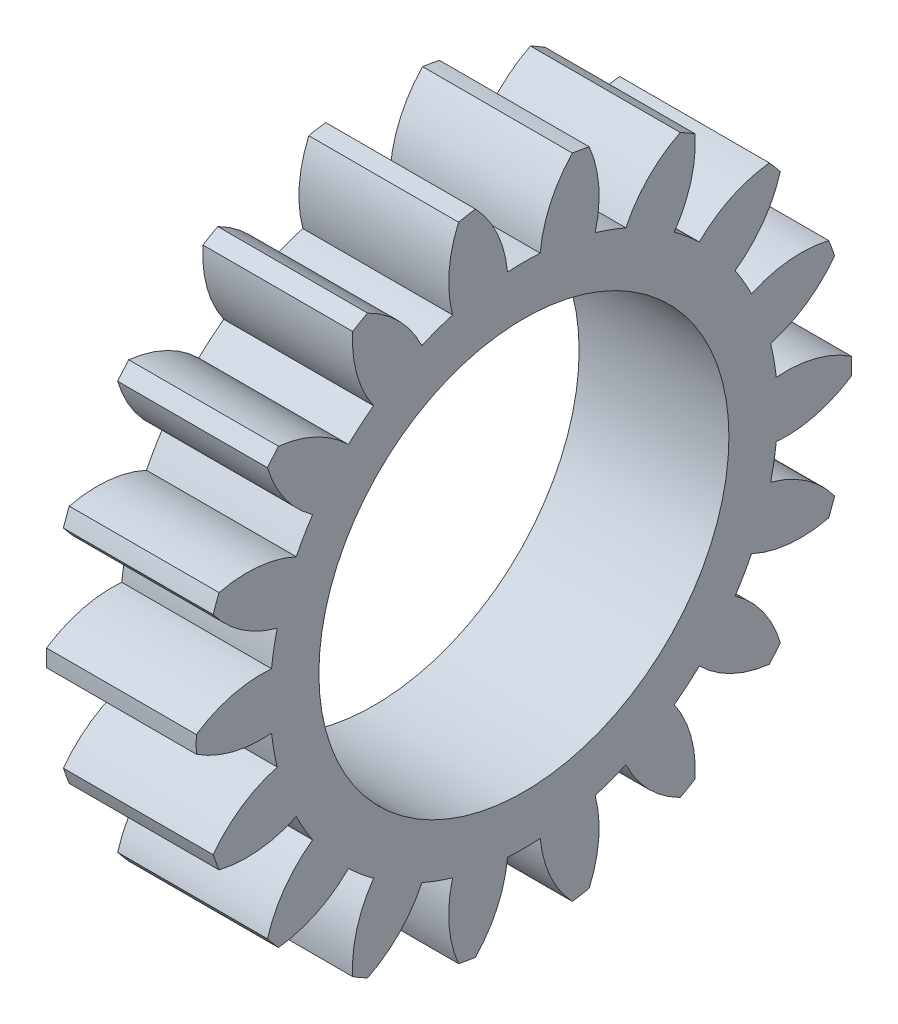
from build123d import *

# Parameters (mm, degrees)
BASPROSKE_W             = 8
BASPROSKE_H             = 17.5
TOOTHCUT_DEPTH          = 27.009613607
TEETHCUTS_COUNT         = 18
TEETHCUTS_ANGLE         = 340
BORSKE_R                = 4
BORE_DEPTH              = 50.0000508
ESQUISSE1_R             = 10.95
ENL_V_MAT_EXTRU_1_DEPTH = 10


with BuildPart() as part:
    # BasProSke → Base-Revolve (revolve)
    with BuildSketch(Plane(origin=(0, 0, 0), x_dir=(1, 0, 0), z_dir=(0, 1, 0))):
        with Locations((4, 8.75)):
            Rectangle(BASPROSKE_W, BASPROSKE_H)
    revolve(axis=Axis((-10, 0, 0), (1, 0, 0)))

    # TooCutSke → ToothCut (cut, through all)
    with BuildSketch(Plane(origin=(0, 0, 0), x_dir=(0, 0, -1), z_dir=(1, 0, 0))):
        with BuildLine():
            ThreePointArc((0.873326889, 13.533350745), (0, 13.5615), (-0.873326889, 13.533350745))
            ThreePointArc((-0.873326889, 13.533350745), (-1.417662776, 15.579682129), (-2.609262071, 17.330072031))
            ThreePointArc((-2.609262071, 17.330072031), (0, 17.5254), (2.609262071, 17.330072031))
            ThreePointArc((2.609262071, 17.330072031), (1.417662776, 15.579682129), (0.873326889, 13.533350745))
        make_face()
    toothcut = extrude(amount=TOOTHCUT_DEPTH, mode=Mode.SUBTRACT)

    # TeethCuts: ToothCut ×18 about axis
    teethcuts_axis = Axis((-10, 0, 0), (1, 0, 0))
    for i in range(1, TEETHCUTS_COUNT):
        add(toothcut.rotate(teethcuts_axis, i * TEETHCUTS_ANGLE / (TEETHCUTS_COUNT - 1)), mode=Mode.SUBTRACT)

    # BorSke → Bore (cut, symmetric)
    with BuildSketch(Plane(origin=(0, 0, 0), x_dir=(0, 0, -1), z_dir=(1, 0, 0))):
        Circle(BORSKE_R)
    extrude(amount=BORE_DEPTH, both=True, mode=Mode.SUBTRACT)

    # Esquisse1 → Enlèv. mat.-Extru.1 (cut)
    with BuildSketch(Plane(origin=(8, 0, 0), x_dir=(0, 0, -1), z_dir=(1, 0, 0))):
        Circle(ESQUISSE1_R)
    extrude(amount=-ENL_V_MAT_EXTRU_1_DEPTH, mode=Mode.SUBTRACT)


solid = part.part
